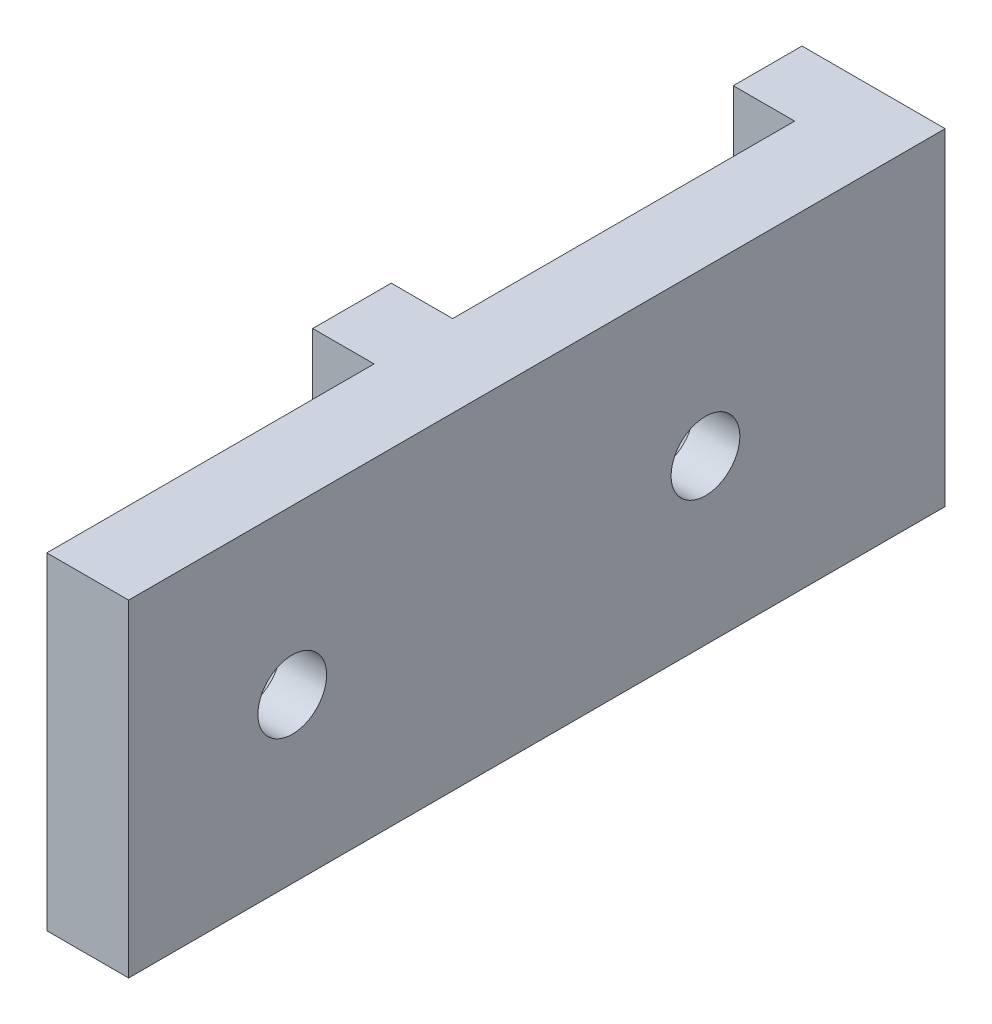
from build123d import *

# Parameters (mm, degrees)
SKETCH1_W                    = 6.096
SKETCH1_H                    = 25.4
BOSS_EXTRUDE1_DEPTH          = 4.7625
SKETCH2_W                    = 69.85
SKETCH2_H                    = 25.4
BOSS_EXTRUDE2_DEPTH          = 6.35
SKETCH5_W                    = 5.334
SKETCH5_H                    = 25.4
BOSS_EXTRUDE3_DEPTH          = 4.7625
CUT_EXTRUDE3_REACH           = 48.124
SKETCH6_W                    = 6.477
SKETCH6_H                    = 25.4
CUT_EXTRUDE1_REACH           = 48.124
SKETCH3_R                    = 2.667
SKETCH4_R                    = 4.7625
CUT_EXTRUDE2_DEPTH           = 3.81
CUT_EXTRUDE2_DRAFT           = -37
CUT_EXTRUDE2_PROFILE_2_DEPTH = 3.81
CUT_EXTRUDE2_PROFILE_2_DRAFT = -37


with BuildPart() as part:
    # Sketch1 → Boss-Extrude1 (new body)
    with BuildSketch(Plane(origin=(0, 0, 0), x_dir=(0, 0, -1), z_dir=(1, 0, 0))):
        with Locations((3.048, 12.7)):
            Rectangle(SKETCH1_W, SKETCH1_H)
    extrude(amount=BOSS_EXTRUDE1_DEPTH)

    # Sketch2 → Boss-Extrude2 (add)
    with BuildSketch(Plane(origin=(4.7625, 0, 0), x_dir=(0, 0, -1), z_dir=(1, 0, 0))):
        with Locations((3.048, 12.7)):
            Rectangle(SKETCH2_W, SKETCH2_H)
    extrude(amount=BOSS_EXTRUDE2_DEPTH)

    # Sketch5 → Boss-Extrude3 (add)
    with BuildSketch(Plane.ZY.offset(-4.7625)):
        with Locations((-35.306, 12.7)):
            Rectangle(SKETCH5_W, SKETCH5_H)
    extrude(amount=BOSS_EXTRUDE3_DEPTH)

    # Sketch6 → Cut-Extrude3 (cut, up to next)
    with BuildSketch(Plane.ZY.offset(-4.7625), mode=Mode.PRIVATE) as cut_extrude3_sk1:
        with Locations((28.6385, 12.7)):
            Rectangle(SKETCH6_W, SKETCH6_H)
    cut_extrude3_tool1 = extrude(cut_extrude3_sk1.sketch, amount=-CUT_EXTRUDE3_REACH, mode=Mode.PRIVATE) & part.part
    add(cut_extrude3_tool1.solids().sort_by_distance((4.7625, 12.7, 28.6385))[0], mode=Mode.SUBTRACT)

    # Sketch3 → Cut-Extrude1 (cut, up to next)
    with BuildSketch(Plane.ZY.offset(-4.7625), mode=Mode.PRIVATE) as cut_extrude1_sk1:
        with Locations((-19.3675, 12.7)):
            Circle(SKETCH3_R)
    cut_extrude1_tool1 = extrude(cut_extrude1_sk1.sketch, amount=-CUT_EXTRUDE1_REACH, mode=Mode.PRIVATE) & part.part
    # Sketch3 → Cut-Extrude1 (cut, up to next)
    with BuildSketch(Plane.ZY.offset(-4.7625), mode=Mode.PRIVATE) as cut_extrude1_sk2:
        with Locations((12.7, 12.7)):
            Circle(SKETCH3_R)
    cut_extrude1_tool2 = extrude(cut_extrude1_sk2.sketch, amount=-CUT_EXTRUDE1_REACH, mode=Mode.PRIVATE) & part.part
    add(cut_extrude1_tool1.solids().sort_by_distance((4.7625, 12.7, -19.3675))[0], mode=Mode.SUBTRACT)
    add(cut_extrude1_tool2.solids().sort_by_distance((4.7625, 12.7, 12.7))[0], mode=Mode.SUBTRACT)


with BuildPart() as cut_extrude2_tool:
    # Sketch4 → Cut-Extrude2 (with draft: the straight prism first)
    with BuildSketch(Plane.ZY.offset(-4.7625)):
        with Locations((12.7, 12.7)):
            Circle(SKETCH4_R)
    extrude(amount=-CUT_EXTRUDE2_DEPTH)
    # Cut-Extrude2: the draft: its side faces are tilted about the plane it starts from
    cut_extrude2_sides = [cut_extrude2_tool.faces().sort_by_distance(p)[0] for p in [
        (6.6675, 12.7, 7.9375),
    ]]
    draft(cut_extrude2_sides, Plane.ZY.offset(-4.7625), CUT_EXTRUDE2_DRAFT)


with BuildPart() as part_1:
    add(part.part)

    # Cut-Extrude2: cut by cut_extrude2_tool
    add(cut_extrude2_tool.part, mode=Mode.SUBTRACT)


with BuildPart() as cut_extrude2_profile_2_tool:
    # Sketch4 → Cut-Extrude2 profile 2 (with draft: the straight prism first)
    with BuildSketch(Plane.ZY.offset(-4.7625)):
        with Locations((-19.3675, 12.7)):
            Circle(SKETCH4_R)
    extrude(amount=-CUT_EXTRUDE2_PROFILE_2_DEPTH)
    # Cut-Extrude2 profile 2: the draft: its side faces are tilted about the plane it starts from
    cut_extrude2_profile_2_sides = [cut_extrude2_profile_2_tool.faces().sort_by_distance(p)[0] for p in [
        (6.6675, 12.7, -24.13),
    ]]
    draft(cut_extrude2_profile_2_sides, Plane.ZY.offset(-4.7625), CUT_EXTRUDE2_PROFILE_2_DRAFT)


with BuildPart() as part_2:
    add(part_1.part)

    # Cut-Extrude2 profile 2: cut by cut_extrude2_profile_2_tool
    add(cut_extrude2_profile_2_tool.part, mode=Mode.SUBTRACT)


solid = part_2.part
